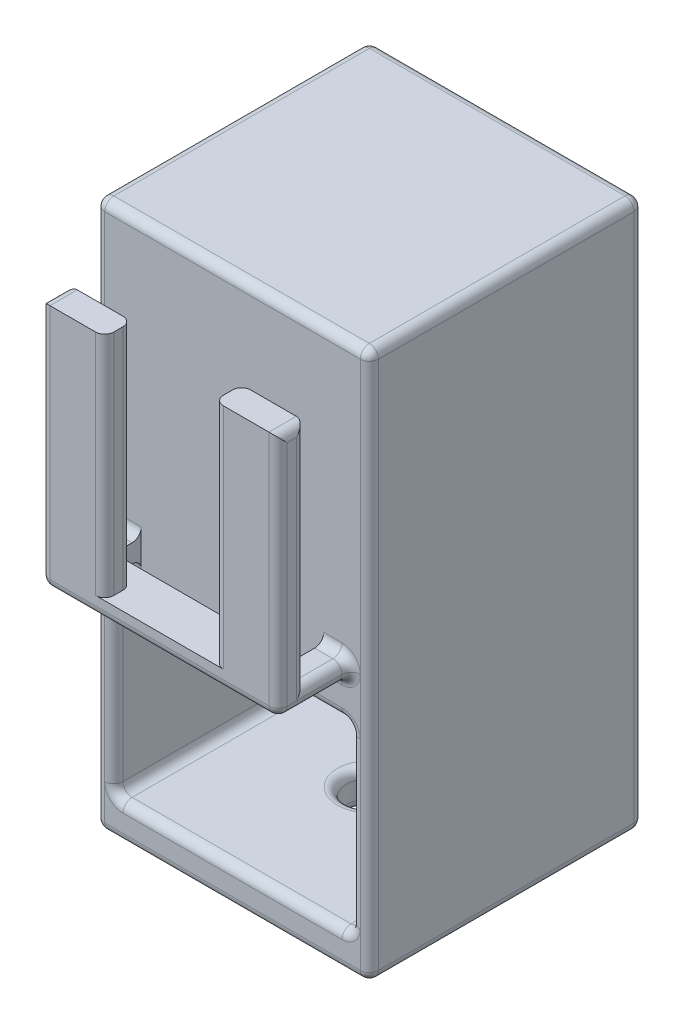
from build123d import *

# Parameters (mm, degrees)
SKETCH3_W             = 7
SKETCH3_H             = 25
BOSS_EXTRUDE2_DEPTH   = 3
BOSS_EXTRUDE2_2_DEPTH = 3
SKETCH4_W             = 5
SKETCH4_H             = 2
BOSS_EXTRUDE3_DEPTH   = 26
SKETCH5_W             = 3
SKETCH5_H             = 2
BOSS_EXTRUDE4_DEPTH   = 3
SKETCH6_W             = 30
SKETCH6_H             = 60
BOSS_EXTRUDE5_DEPTH   = 30
SKETCH7_W             = 26
SKETCH7_H             = 20
CUT_EXTRUDE2_DEPTH    = 43
SKETCH8_R             = 2.5
CUT_EXTRUDE3_DEPTH    = 18
FILLET2_R             = 1
SKETCH9_W             = 26
SKETCH9_H             = 32.627592747
CUT_EXTRUDE4_DEPTH    = 22
FILLET3_R             = 1


with BuildPart() as part:
    # Sketch3 → Boss-Extrude2 (new body)
    with BuildSketch(Plane.XY):
        with Locations((3.5, 12.5)):
            Rectangle(SKETCH3_W, SKETCH3_H)
    extrude(amount=BOSS_EXTRUDE2_DEPTH)



with BuildPart() as body_2:
    # Sketch3 → Boss-Extrude2 2 (new body)
    with BuildSketch(Plane.XY):
        with Locations((22.5, 12.5)):
            Rectangle(SKETCH3_W, SKETCH3_H)
    extrude(amount=BOSS_EXTRUDE2_2_DEPTH)


with BuildPart() as part_1:
    add(part.part)

    add(body_2.part)  # Boss-Extrude3 merges body 2
    # Sketch4 → Boss-Extrude3 (add)
    with BuildSketch(Plane(origin=(26, 0, 0), x_dir=(0, 0, -1), z_dir=(1, 0, 0))):
        with Locations((-0.5, -1)):
            Rectangle(SKETCH4_W, SKETCH4_H)
    extrude(amount=-BOSS_EXTRUDE3_DEPTH)

    # Sketch5 → Boss-Extrude4 (add)
    with BuildSketch(Plane(origin=(0, 0, -2), x_dir=(-1, 0, 0), z_dir=(0, 0, -1))):
        with Locations((-24.5, -1)):
            Rectangle(SKETCH5_W, SKETCH5_H)
        with Locations((-1.5, -1)):
            Rectangle(SKETCH5_W, SKETCH5_H)
    extrude(amount=BOSS_EXTRUDE4_DEPTH)

    # Sketch6 → Boss-Extrude5 (add)
    with BuildSketch(Plane(origin=(0, 0, -5), x_dir=(-1, 0, 0), z_dir=(0, 0, -1))):
        with Locations((-13, -0.080088983)):
            Rectangle(SKETCH6_W, SKETCH6_H)
    extrude(amount=BOSS_EXTRUDE5_DEPTH)

    # Sketch7 → Cut-Extrude2 (cut)
    with BuildSketch(Plane.XY.offset(-5)):
        with Locations((13, -16.156846809)):
            Rectangle(SKETCH7_W, SKETCH7_H)
    extrude(amount=-CUT_EXTRUDE2_DEPTH, mode=Mode.SUBTRACT)

    # Sketch8 → Cut-Extrude3 (cut)
    with BuildSketch(Plane.XZ.offset(30.080088983)):
        with Locations(Location((13, -20, 0), (0, 0, 270))):
            Circle(SKETCH8_R)
    extrude(amount=-CUT_EXTRUDE3_DEPTH, mode=Mode.SUBTRACT)

    # Fillet2
    fillet2_edges = [part_1.edges().sort_by_distance(p)[0] for p in [
        (7, 12.5, 3),
        (13, -2, 3),
        (0, 0, -2.5),
        (0, -2, -1),
        (26, 11.5, 3),
        (26, -2, -1),
        (26, 0, -2.5),
        (0, 11.5, 3),
        (19, 12.5, 3),
        (26, 12.5, 0),
        (26, 25, 1.5),
        (19, 12.5, 0),
        (26, -1, -5),
        (24.5, -2, -5),
        (24.5, 0, -5),
        (0, -1, -5),
        (1.5, 0, -5),
        (1.5, -2, -5),
        (0, 12.5, 0),
        (7, 12.5, 0),
        (0, 25, 1.5),
    ]]
    fillet(fillet2_edges, radius=FILLET2_R - 0.0001)  # a hair under: the kernel refuses the full size

    # Sketch9 → Cut-Extrude4 (cut)
    with BuildSketch(Plane(origin=(0, 0, -35), x_dir=(-1, 0, 0), z_dir=(0, 0, -1))):
        with Locations((-13, 8.423565831)):
            Rectangle(SKETCH9_W, SKETCH9_H)
    extrude(amount=-CUT_EXTRUDE4_DEPTH, mode=Mode.SUBTRACT)

    # Fillet3
    fillet3_edges = [part_1.edges().sort_by_distance(p)[0] for p in [
        (13, -26.156846809, -17.5),
        (13, -30.080088983, -17.5),
        (26, -6.156846809, -9),
        (0, -6.156846809, -9),
        (26, 9.290257698, -13),
        (0, 9.290257698, -13),
        (13, -6.156846809, -13),
        (13, 24.737362205, -35),
        (13, 24.737362205, -13),
        (28, -0.080088983, -35),
        (28, 29.919911017, -20),
        (13, -30.080088983, -5),
        (28, -30.080088983, -20),
        (-2, -0.080088983, -5),
        (-2, -30.080088983, -20),
        (13, 29.919911017, -35),
        (-2, 29.919911017, -20),
        (13, -30.080088983, -35),
        (-2, -0.080088983, -35),
        (28, -0.080088983, -5),
        (13, 29.919911017, -5),
        (0, -0.709742302, -35),
        (0, -26.156846809, -20),
        (26, -0.709742302, -35),
        (13, -26.156846809, -35),
        (26, -26.156846809, -20),
        (0, -16.156846809, -5),
        (13, -26.156846809, -5),
        (26, -16.156846809, -5),
        (13, -6.156846809, -5),
    ]]
    fillet(fillet3_edges, radius=FILLET3_R - 0.0001)  # a hair under: the kernel refuses the full size


solid = part_1.part
